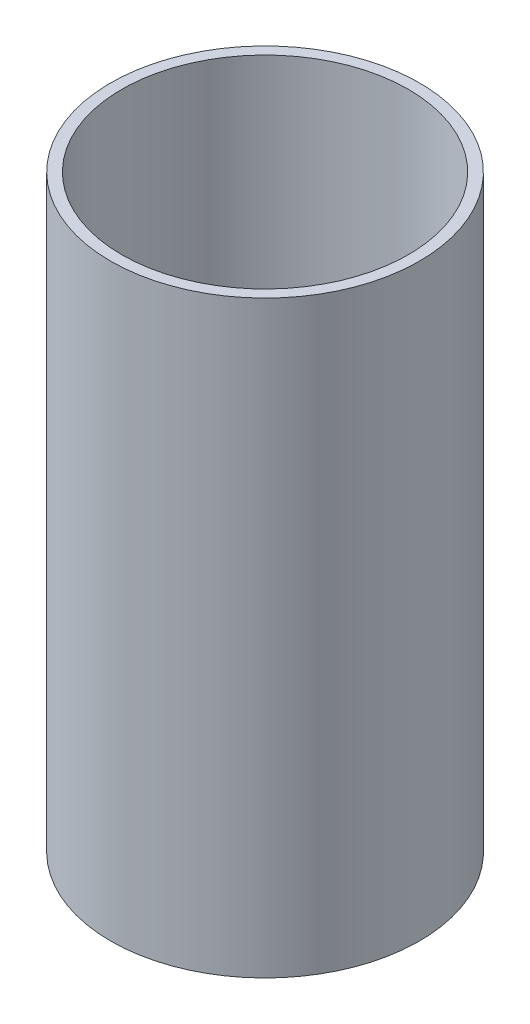
from build123d import *

# Parameters (mm, degrees)
SKETCH1_R           = 44.45
SKETCH1_R_2         = 41.25
BOSS_EXTRUDE1_DEPTH = 169.5


with BuildPart() as part:
    # Sketch1 → Boss-Extrude1 (new body)
    with BuildSketch(Plane(origin=(0, 0, 0), x_dir=(1, 0, 0), z_dir=(0, 1, 0))):
        Circle(SKETCH1_R)
        Circle(SKETCH1_R_2, mode=Mode.SUBTRACT)
    extrude(amount=BOSS_EXTRUDE1_DEPTH)


solid = part.part
